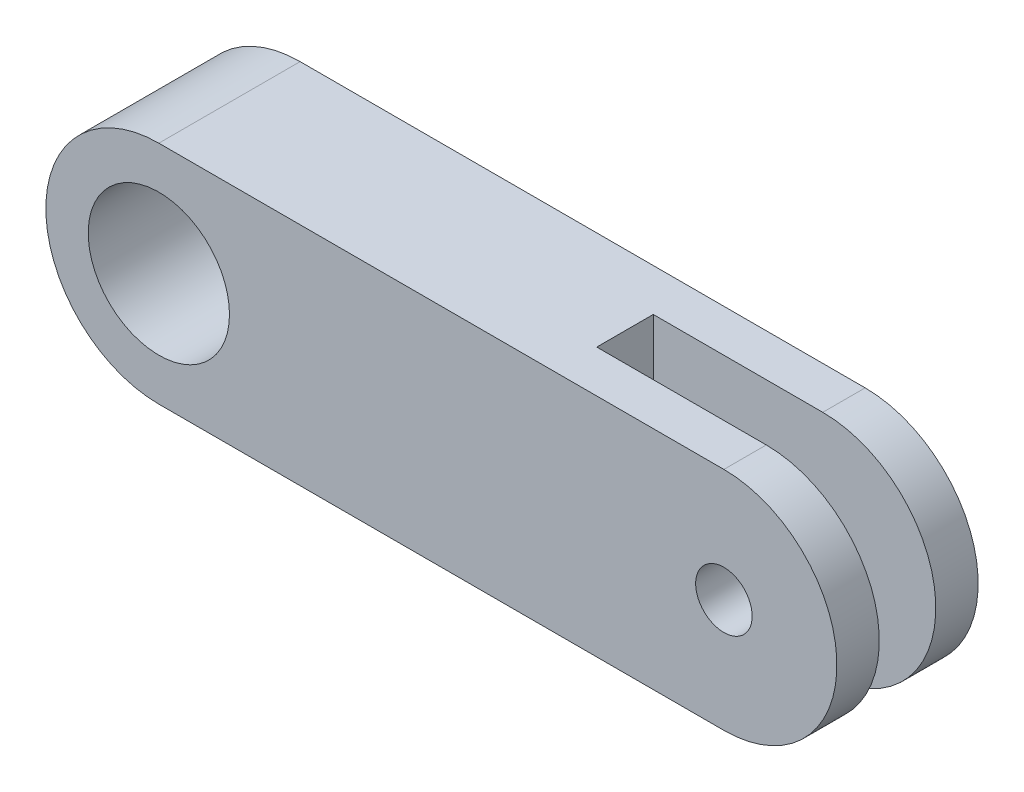
from build123d import *

# Parameters (mm, degrees)
SKETCH1_R           = 2.5
SKETCH1_R_2         = 1
BOSS_EXTRUDE1_DEPTH = 2.5
SKETCH5_W           = 10
SKETCH5_H           = 8
CUT_EXTRUDE1_DEPTH  = 1


with BuildPart() as part:
    # Sketch1 → Boss-Extrude1 (new, symmetric)
    with BuildSketch(Plane.XY):
        with BuildLine():
            Line((-10, 4), (10, 4))
            ThreePointArc((10, 4), (14, 0), (10, -4))
            Line((10, -4), (-10, -4))
            ThreePointArc((-10, -4), (-14, 0), (-10, 4))
        make_face()
        with Locations((-10, 0)):
            Circle(SKETCH1_R, mode=Mode.SUBTRACT)
        with Locations((10, 0)):
            Circle(SKETCH1_R_2, mode=Mode.SUBTRACT)
    extrude(amount=BOSS_EXTRUDE1_DEPTH, both=True)

    # Sketch5 → Cut-Extrude1 (cut, symmetric)
    with BuildSketch(Plane.XY):
        with Locations((9, 0)):
            Rectangle(SKETCH5_W, SKETCH5_H)
    extrude(amount=CUT_EXTRUDE1_DEPTH, both=True, mode=Mode.SUBTRACT)


solid = part.part
